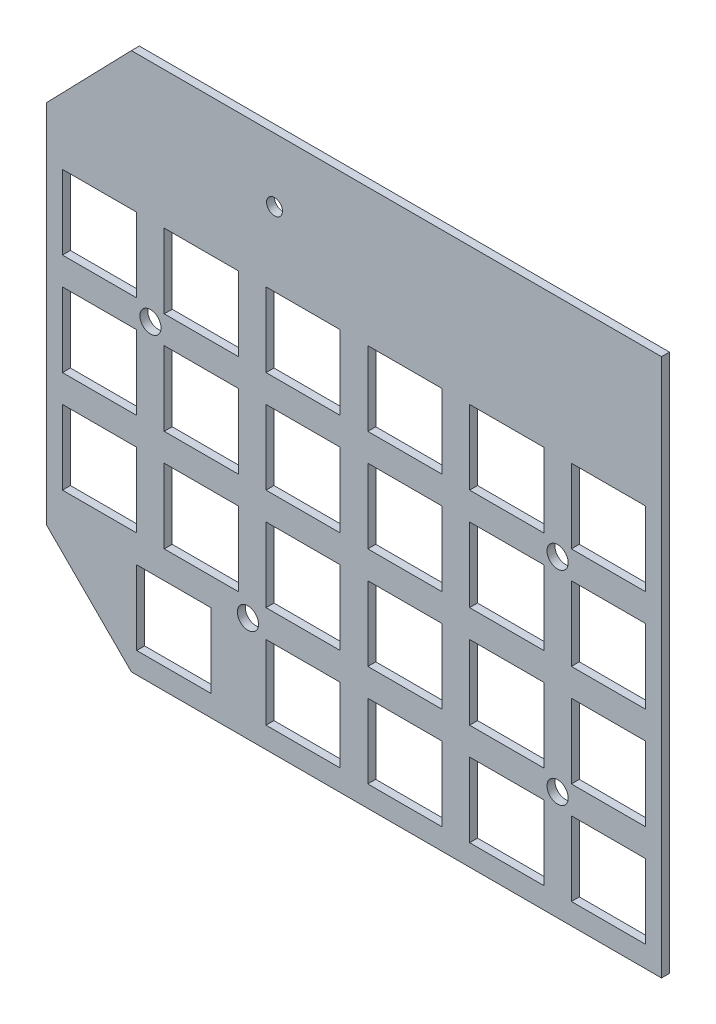
from build123d import *

# Parameters (mm, degrees)
BOSS_EXTRU_1_DEPTH      = 1.5
ESQUISSE3_R             = 2
ESQUISSE3_R_2           = 1.5
ESQUISSE3_W             = 14
ESQUISSE3_H             = 14
ENL_V_MAT_EXTRU_2_DEPTH = 10


with BuildPart() as part:
    # Esquisse1 → Boss.-Extru.1 (new body)
    with BuildSketch(Plane.XY):
        Polygon((0, -85), (16, -101), (116, -101), (116, 0.5), (16, 0.5), (0, -16), align=None)
    extrude(amount=BOSS_EXTRU_1_DEPTH)

    # Esquisse3 → Enlèv. mat.-Extru.2 (cut)
    with BuildSketch(Plane(origin=(0, 0, 0), x_dir=(-1, 0, 0), z_dir=(0, 0, -1))):
        with Locations((-96.4, -42)):
            Circle(ESQUISSE3_R)
        with Locations((-19.6, -42)):
            Circle(ESQUISSE3_R)
        with Locations((-37.98939693, -81.21060307)):
            Circle(ESQUISSE3_R)
        with Locations((-96.4, -80.4)):
            Circle(ESQUISSE3_R)
        with Locations((-43, -11.5)):
            Circle(ESQUISSE3_R_2)
        with Locations((-86.8, -32.4)):
            Rectangle(ESQUISSE3_W, ESQUISSE3_H)
        with Locations((-106, -32.4)):
            Rectangle(ESQUISSE3_W, ESQUISSE3_H)
        with Locations((-67.6, -32.4)):
            Rectangle(ESQUISSE3_W, ESQUISSE3_H)
        with Locations((-48.4, -32.4)):
            Rectangle(ESQUISSE3_W, ESQUISSE3_H)
        with Locations((-29.2, -32.4)):
            Rectangle(ESQUISSE3_W, ESQUISSE3_H)
        with Locations((-10, -32.4)):
            Rectangle(ESQUISSE3_W, ESQUISSE3_H)
        with Locations((-86.8, -51.6)):
            Rectangle(ESQUISSE3_W, ESQUISSE3_H)
        with Locations((-67.6, -51.6)):
            Rectangle(ESQUISSE3_W, ESQUISSE3_H)
        with Locations((-48.4, -51.6)):
            Rectangle(ESQUISSE3_W, ESQUISSE3_H)
        with Locations((-29.2, -51.6)):
            Rectangle(ESQUISSE3_W, ESQUISSE3_H)
        with Locations((-10, -51.6)):
            Rectangle(ESQUISSE3_W, ESQUISSE3_H)
        with Locations((-86.8, -70.8)):
            Rectangle(ESQUISSE3_W, ESQUISSE3_H)
        with Locations((-67.6, -70.8)):
            Rectangle(ESQUISSE3_W, ESQUISSE3_H)
        with Locations((-48.4, -70.8)):
            Rectangle(ESQUISSE3_W, ESQUISSE3_H)
        with Locations((-29.2, -70.8)):
            Rectangle(ESQUISSE3_W, ESQUISSE3_H)
        with Locations((-10, -70.8)):
            Rectangle(ESQUISSE3_W, ESQUISSE3_H)
        with Locations((-86.8, -90)):
            Rectangle(ESQUISSE3_W, ESQUISSE3_H)
        with Locations((-67.6, -90)):
            Rectangle(ESQUISSE3_W, ESQUISSE3_H)
        with Locations((-48.4, -90)):
            Rectangle(ESQUISSE3_W, ESQUISSE3_H)
        with Locations((-106, -51.6)):
            Rectangle(ESQUISSE3_W, ESQUISSE3_H)
        with Locations((-106, -70.8)):
            Rectangle(ESQUISSE3_W, ESQUISSE3_H)
        with Locations((-106, -90)):
            Rectangle(ESQUISSE3_W, ESQUISSE3_H)
        with Locations((-24, -90)):
            Rectangle(ESQUISSE3_W, ESQUISSE3_H)
    extrude(amount=-ENL_V_MAT_EXTRU_2_DEPTH, mode=Mode.SUBTRACT)


solid = part.part
